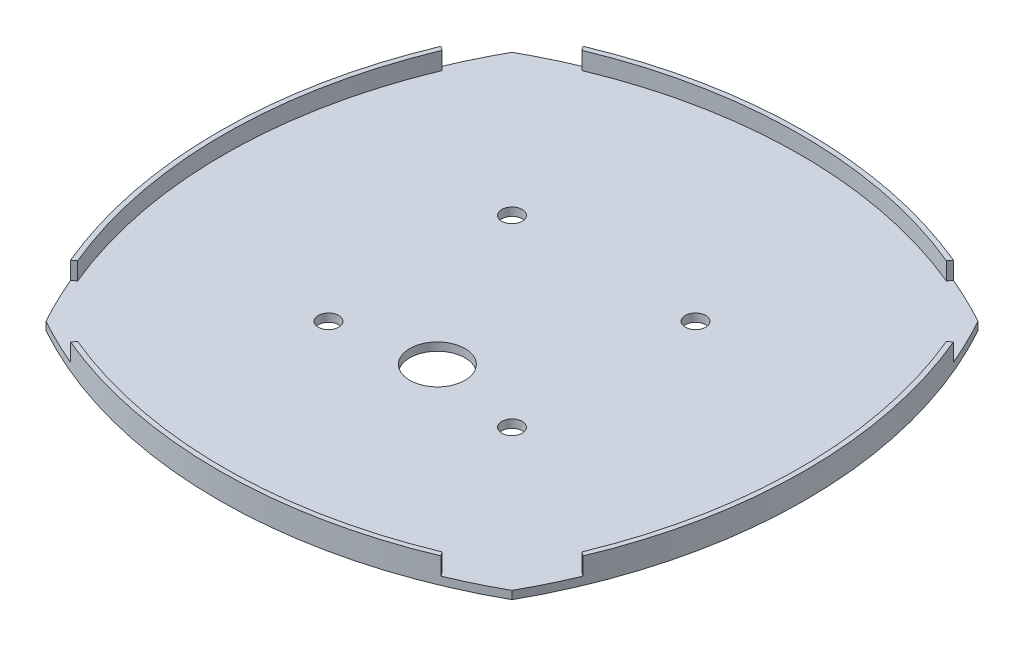
from build123d import *

# Parameters (mm, degrees)
BOSS_EXTRUDE1_DEPTH     = 2.5
BOSS_EXTRUDE2_DEPTH     = 5.4
CUT_EXTRUDE2_DEPTH      = 324.312541101
CUT_EXTRUDE2_DEPTH_BACK = 324.312541101
SKETCH11_R              = 3.15
SKETCH11_R_2            = 8.5


with BuildPart() as part:
    # Sketch3 → Boss-Extrude1 (new body)
    with BuildSketch(Plane(origin=(0, 0, 0), x_dir=(1, 0, 0), z_dir=(0, 1, 0))):
        with BuildLine():
            ThreePointArc((271.153533245, 18.921159404), (199.331937646, 37.525228411), (127.510342047, 18.921159404))
            ThreePointArc((127.510342047, 18.921159404), (108.90627304, -52.900436194), (127.510342047, -124.722031793))
            ThreePointArc((127.510342047, -124.722031793), (199.331937646, -143.3261008), (271.153533245, -124.722031793))
            ThreePointArc((271.153533245, -124.722031793), (289.757602252, -52.900436194), (271.153533245, 18.921159404))
        make_face()
    extrude(amount=BOSS_EXTRUDE1_DEPTH)

    # Sketch5 → Boss-Extrude2 (add)
    with BuildSketch(Plane(origin=(0, 2.5, 0), x_dir=(1, 0, 0), z_dir=(0, 1, 0))):
        with BuildLine():
            Line((121.611565862, -109.080289564), (120.36423024, -109.98653194))
            ThreePointArc((120.36423024, -109.98653194), (108.906273045, -52.899217103), (120.365171108, 4.187908885))
            Line((120.365171108, 4.187908885), (121.612501818, 3.281670078))
            ThreePointArc((121.612501818, 3.281670078), (110.406273045, -52.899216401), (121.611565862, -109.080289564))
        make_face()
        with BuildLine():
            Line((143.152084277, -130.620807978), (142.2458419, -131.8681436))
            ThreePointArc((142.2458419, -131.8681436), (199.331937646, -143.3261008), (256.418033392, -131.8681436))
            Line((256.418033392, -131.8681436), (255.511791015, -130.620807978))
            ThreePointArc((255.511791015, -130.620807978), (199.331937646, -141.8261008), (143.152084277, -130.620807978))
        make_face()
        with BuildLine():
            Line((277.052309429, 3.279417175), (278.299645052, 4.185659552))
            ThreePointArc((278.299645052, 4.185659552), (289.757602252, -52.900436194), (278.299645052, -109.98653194))
            Line((278.299645052, -109.98653194), (277.052309429, -109.080289564))
            ThreePointArc((277.052309429, -109.080289564), (288.257602252, -52.900436194), (277.052309429, 3.279417175))
        make_face()
        with BuildLine():
            Line((255.511791015, 24.819935589), (256.418033392, 26.067271212))
            ThreePointArc((256.418033392, 26.067271212), (199.330718555, 37.525228406), (142.243592567, 26.066330343))
            Line((142.243592567, 26.066330343), (143.149831374, 24.818999633))
            ThreePointArc((143.149831374, 24.818999633), (199.330717853, 36.025228406), (255.511791015, 24.819935589))
        make_face()
    extrude(amount=BOSS_EXTRUDE2_DEPTH)

    # Sketch11 → Cut-Extrude2 (cut, two sides: drawn at the far end of the back side and taken through both)
    with BuildSketch(Plane(origin=(0, 2.5, 0), x_dir=(1, 0, 0), z_dir=(0, 1, 0)).offset(-CUT_EXTRUDE2_DEPTH_BACK)):
        with Locations((171.047666398, -24.616164947)):
            Circle(SKETCH11_R)
        with Locations((227.616208893, -24.616164947)):
            Circle(SKETCH11_R)
        with Locations((227.616208893, -81.184707442)):
            Circle(SKETCH11_R)
        with Locations((171.047666398, -81.184707442)):
            Circle(SKETCH11_R)
        with Locations((199.331937646, -75.900436194)):
            Circle(SKETCH11_R_2)
    extrude(amount=CUT_EXTRUDE2_DEPTH + CUT_EXTRUDE2_DEPTH_BACK, mode=Mode.SUBTRACT)


solid = part.part
